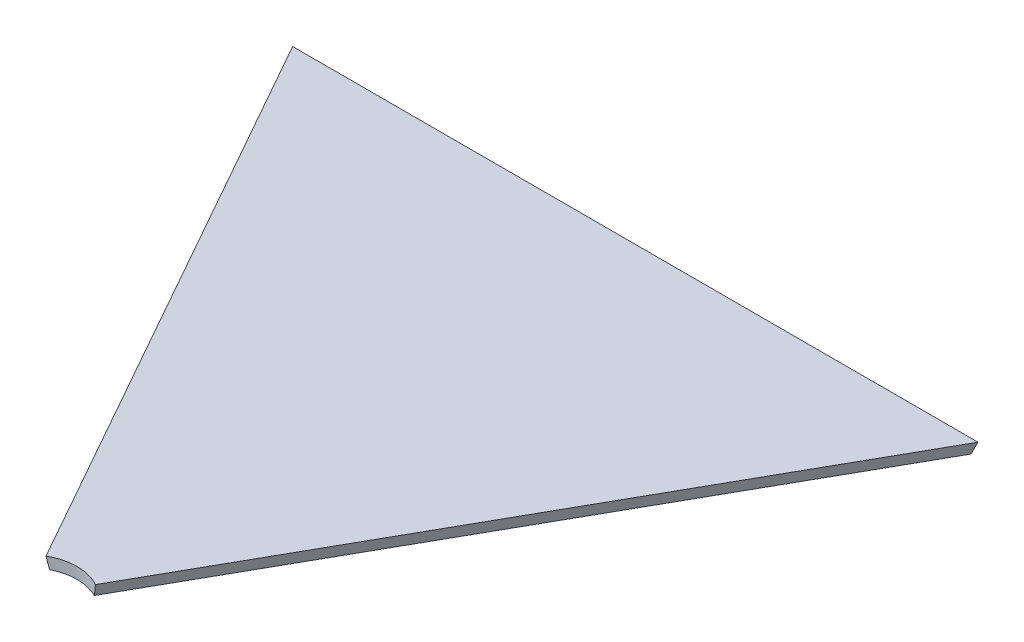
from build123d import *
from OCP.BRepFilletAPI import BRepFilletAPI_MakeChamfer

# Parameters (mm, degrees)
BOSS_EXTRUDE1_DEPTH = 10
CHAMFER1_SIZE       = 10
CHAMFER1_SIZE_2     = 2.308681911


with BuildPart() as part:
    # Sketch1 → Boss-Extrude1 (new body)
    with BuildSketch(Plane(origin=(0, 0, 0), x_dir=(1, 0, 0), z_dir=(0, 1, 0))):
        with BuildLine():
            Line((-306, 0), (306, 0))
            Line((306, 0), (22.078307516, -504.188415778))
            ThreePointArc((22.078307516, -504.188415778), (0, -498.4), (-22.078307516, -504.188415778))
            Line((-22.078307516, -504.188415778), (-306, 0))
        make_face()
    extrude(amount=BOSS_EXTRUDE1_DEPTH)

    # Chamfer1
    chamfer1_edges_1 = [part.edges().sort_by_distance(p)[0] for p in [
        (-164.039153758, 0, 252.094207889),
    ]]
    chamfer1_side_1 = [part.faces().sort_by_distance(p)[0] for p in [
        (-164.039153758, 0.046173638, 252.094207889),
    ]]
    chamfer1_edges_2 = [part.edges().sort_by_distance(p)[0] for p in [
        (0, 0, 0),
    ]]
    chamfer1_side_2 = [part.faces().sort_by_distance(p)[0] for p in [
        (0, 0.046173638, 0),
    ]]
    chamfer1_edges_3 = [part.edges().sort_by_distance(p)[0] for p in [
        (164.039153758, 0, 252.094207889),
    ]]
    chamfer1_side_3 = [part.faces().sort_by_distance(p)[0] for p in [
        (164.039153758, 0.046173638, 252.094207889),
    ]]
    chamfer1 = BRepFilletAPI_MakeChamfer(part.part.solid().wrapped)
    for e in chamfer1_edges_1:
        chamfer1.Add(CHAMFER1_SIZE - 0.0001, CHAMFER1_SIZE_2 - 0.0001, e.wrapped, chamfer1_side_1[0].wrapped)
    for e in chamfer1_edges_2:
        chamfer1.Add(CHAMFER1_SIZE - 0.0001, CHAMFER1_SIZE_2 - 0.0001, e.wrapped, chamfer1_side_2[0].wrapped)
    for e in chamfer1_edges_3:
        chamfer1.Add(CHAMFER1_SIZE - 0.0001, CHAMFER1_SIZE_2 - 0.0001, e.wrapped, chamfer1_side_3[0].wrapped)
    add(Compound.cast(chamfer1.Shape()), mode=Mode.REPLACE)  # a hair under: the kernel refuses the full size


solid = part.part
